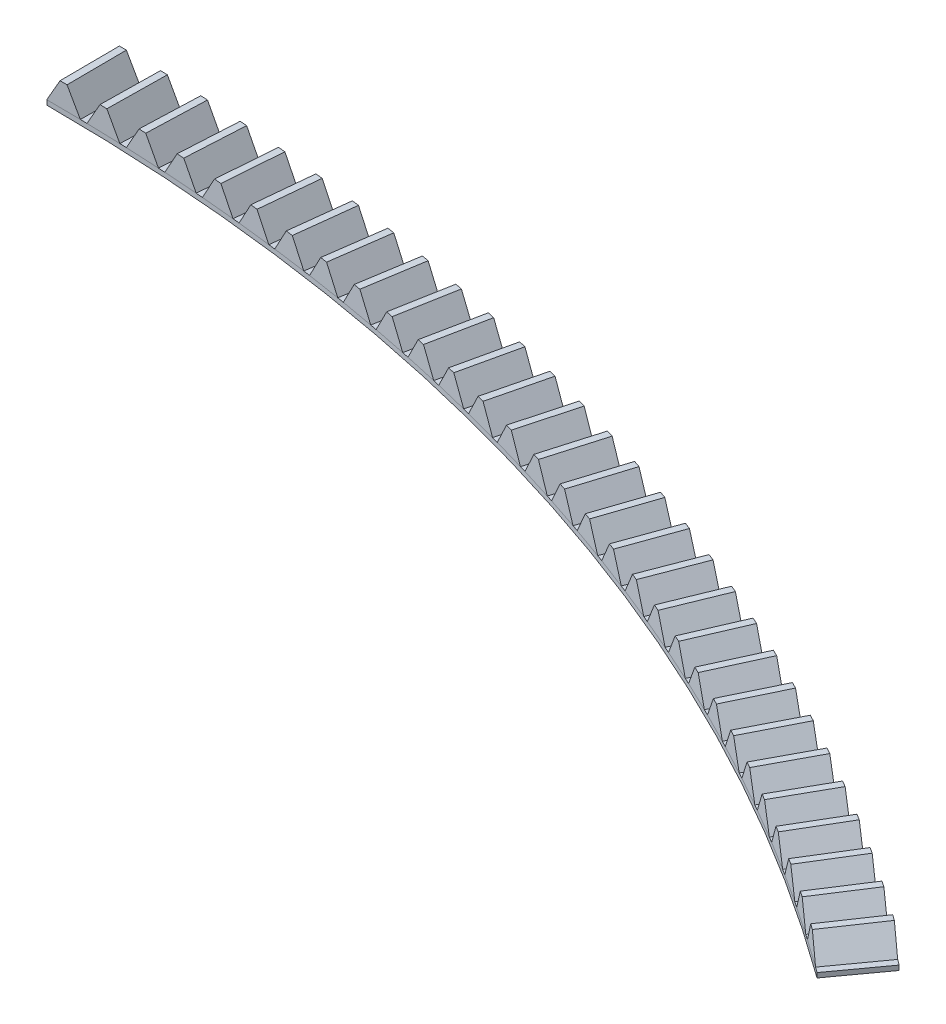
from build123d import *

# Parameters (mm, degrees)
BOSS_EXTRUDE1_DEPTH = 0.254
CIRPATTERN1_COUNT   = 30
CIRPATTERN1_ANGLE   = 34.8


with BuildPart() as part:
    # Sketch1 → Boss-Extrude1 (new body)
    with BuildSketch(Plane(origin=(0, 0, 0), x_dir=(1, 0, 0), z_dir=(0, 1, 0))):
        with BuildLine():
            Line((0, 107.95), (0, 104.775))
            ThreePointArc((0, 104.775), (0.914322757, 104.771010489), (1.828575884, 104.75904226))
            Line((1.828575884, 104.75904226), (1.883987275, 107.933558692))
            ThreePointArc((1.883987275, 107.933558692), (0.942029507, 107.945889595), (0, 107.95))
        make_face()
        with BuildLine():
            Line((1.883987275, 107.933558692), (1.828575884, 104.75904226))
            ThreePointArc((1.828575884, 104.75904226), (33.245595375, 99.360610974), (61.585199809, 84.764755586))
            Line((61.585199809, 84.764755586), (63.451417985, 87.333384543))
            ThreePointArc((63.451417985, 87.333384543), (34.253037659, 102.37153858), (1.883987275, 107.933558692))
        make_face()
    extrude(amount=BOSS_EXTRUDE1_DEPTH)

    # Loft2: read off the stored shape, not the designer's step
    # Loft2: loft between two sections, ruled curve by curve
    loft2_from = [
        Edge.make_line((1.828575884, 0.254, -104.75904226), (1.104780689, 1.507697791, -104.765358725)),
        Edge.make_line((1.104780689, 1.507697791, -104.765358725), (0.723795196, 1.507697791, -104.768683535)),
        Edge.make_line((0.723795196, 1.507697791, -104.768683535), (0, 0.254, -104.775)),
        Edge.make_line((0, 0.254, -104.775), (1.828575884, 0.254, -104.75904226)),
    ]
    loft2_to = [
        Edge.make_line((1.883987275, 0.254, -107.933558692), (1.132486384, 1.55568729, -107.940116941)),
        Edge.make_line((1.132486384, 1.55568729, -107.940116941), (0.751500891, 1.55568729, -107.943441751)),
        Edge.make_line((0.751500891, 1.55568729, -107.943441751), (0, 0.254, -107.95)),
        Edge.make_line((0, 0.254, -107.95), (1.883987275, 0.254, -107.933558692)),
    ]
    loft2 = Solid(Shell([*[Face.make_surface_from_curves(loft2_from[k], loft2_to[k]) for k in range(4)], Face(Wire(loft2_from)), Face(Wire(loft2_to))]))
    add(loft2)

    # CirPattern1: Loft2 ×30 about axis
    cirpattern1_axis = Axis((0, 0, 0), (0, -1, 0))
    for i in range(1, CIRPATTERN1_COUNT):
        add(loft2.rotate(cirpattern1_axis, i * CIRPATTERN1_ANGLE / (CIRPATTERN1_COUNT - 1)))


solid = part.part
